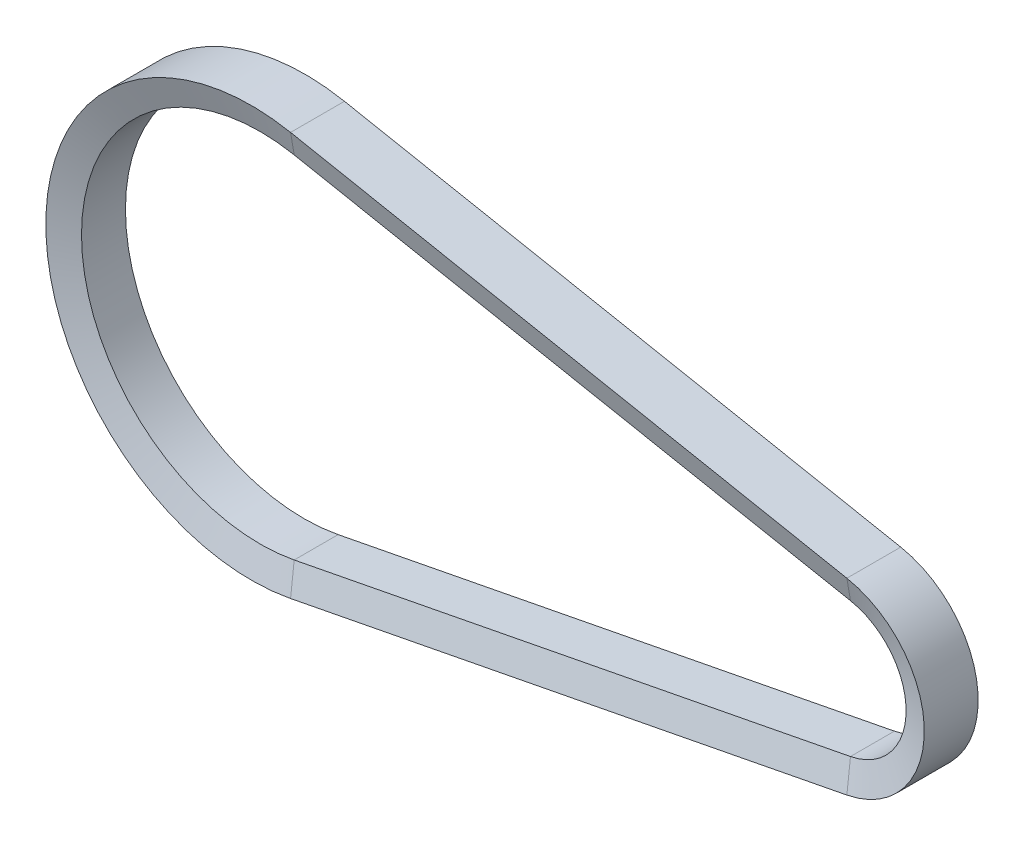
from build123d import *

# Parameters (mm, degrees)
BOSS_EXTRUDE2_DEPTH = 19.6
CHAMFER1_SIZE       = 3.184213023
CHAMFER1_SIZE_2     = 9.8
CHAMFER2_SIZE       = 9.8
CHAMFER2_SIZE_2     = 0.427877241


with BuildPart() as part:
    # Sketch4 → Boss-Extrude2 (new body)
    with BuildSketch(Plane.XY):
        with BuildLine():
            Line((14.247619048, -73.430547809), (216.628571429, -34.162875184))
            ThreePointArc((216.628571429, -34.162875184), (244.8, 0), (216.628571429, 34.162875184))
            Line((216.628571429, 34.162875184), (14.247619048, 73.430547809))
            ThreePointArc((14.247619048, 73.430547809), (-74.8, 0), (14.247619048, -73.430547809))
        make_face()
        with BuildLine():
            Line((12.380952381, 63.809968016), (214.761904762, 24.542295391))
            ThreePointArc((214.761904762, 24.542295391), (235, 0), (214.761904762, -24.542295391))
            Line((214.761904762, -24.542295391), (12.380952381, -63.809968016))
            ThreePointArc((12.380952381, -63.809968016), (-65, 0), (12.380952381, 63.809968016))
        make_face(mode=Mode.SUBTRACT)
    extrude(amount=BOSS_EXTRUDE2_DEPTH)

    # Chamfer1
    # the kernel refuses this chamfer: 9.8, 3.184213023 mm, written as the material it takes off along each edge
    with BuildSketch(Plane(origin=(0, 0, 19.6), x_dir=(0.19047619047619063, -0.9816918156232525, 0), z_dir=(0.9816918156232525, 0.19047619047619063, 0))) as chamfer1_piece_1:
        Polygon((65, CHAMFER1_SIZE), (65 + CHAMFER1_SIZE_2, 0), (65, 0), align=None)
    revolve(axis=Axis((0, 0, 19.6), (0, 0, -1)), revolution_arc=201.961150855, mode=Mode.SUBTRACT)
    with BuildSketch(Plane(origin=(214.761904762, -24.542295391, 19.6), x_dir=(-0.021348671206160026, 0.1100285329369752, -0.9936991275921844), z_dir=(-0.9816918156232526, -0.1904761904761905, 0)), Plane(origin=(12.380952381, 63.809968016, 19.6), x_dir=(-0.021348671206159867, -0.1100285329369744, -0.9936991275921844), z_dir=(0.9816918156232526, -0.1904761904761905, 0))) as chamfer1_piece_2:
        Polygon((CHAMFER1_SIZE * 0.993699127618, CHAMFER1_SIZE * 0.112080523835), (-CHAMFER1_SIZE_2 * 0.112080523832, CHAMFER1_SIZE_2 * 0.993699127592), (0, 0), align=None)
    extrude(amount=206.155281281, mode=Mode.SUBTRACT)
    with BuildSketch(Plane(origin=(210, 0, 19.6), x_dir=(0.19047619047619035, 0.9816918156232525, 0), z_dir=(-0.9816918156232525, 0.19047619047619035, 0))) as chamfer1_piece_3:
        Polygon((25, CHAMFER1_SIZE), (25 + CHAMFER1_SIZE_2, 0), (25, 0), align=None)
    revolve(axis=Axis((210, 0, 19.6), (0, 0, -1)), revolution_arc=158.038849145, mode=Mode.SUBTRACT)

    # Chamfer2
    # the kernel refuses this chamfer: 9.8, 0.427877241 mm, written as the material it takes off along each edge
    with BuildSketch(Plane(origin=(0, 0, 0), x_dir=(0.19047619047619063, -0.9816918156232525, 0), z_dir=(0.9816918156232525, 0.19047619047619063, 0))) as chamfer2_piece_1:
        Polygon((65 + CHAMFER2_SIZE, 0), (65, -CHAMFER2_SIZE_2 * 0.999999998839), (65, 0), align=None)
    revolve(axis=Axis((0, 0, 0), (0, 0, -1)), revolution_arc=201.961150855, mode=Mode.SUBTRACT)
    with BuildSketch(Plane(origin=(214.761904762, -24.542295391, 0), x_dir=(0.1904759224026141, -0.9816904340036641, -0.0016777278000430975), z_dir=(-0.9816918156232526, -0.1904761904761905, 0)), Plane(origin=(12.380952381, 63.809968016, 0), x_dir=(0.19047592240261413, 0.9816904340036641, -0.0016777278000430988), z_dir=(0.9816918156232526, -0.1904761904761905, 0))) as chamfer2_piece_2:
        Polygon((CHAMFER2_SIZE * 0.999998592614, CHAMFER2_SIZE * 0.00167772780004), (-CHAMFER2_SIZE_2 * 0.0016777277981, CHAMFER2_SIZE_2 * 0.999998591453), (0, 0), align=None)
    extrude(amount=206.155281281, mode=Mode.SUBTRACT)
    with BuildSketch(Plane(origin=(210, 0, 0), x_dir=(0.19047619047619035, 0.9816918156232525, 0), z_dir=(-0.9816918156232525, 0.19047619047619035, 0))) as chamfer2_piece_3:
        Polygon((25 + CHAMFER2_SIZE, 0), (25, -CHAMFER2_SIZE_2 * 0.999999998839), (25, 0), align=None)
    revolve(axis=Axis((210, 0, 0), (0, 0, -1)), revolution_arc=158.038849145, mode=Mode.SUBTRACT)


solid = part.part
